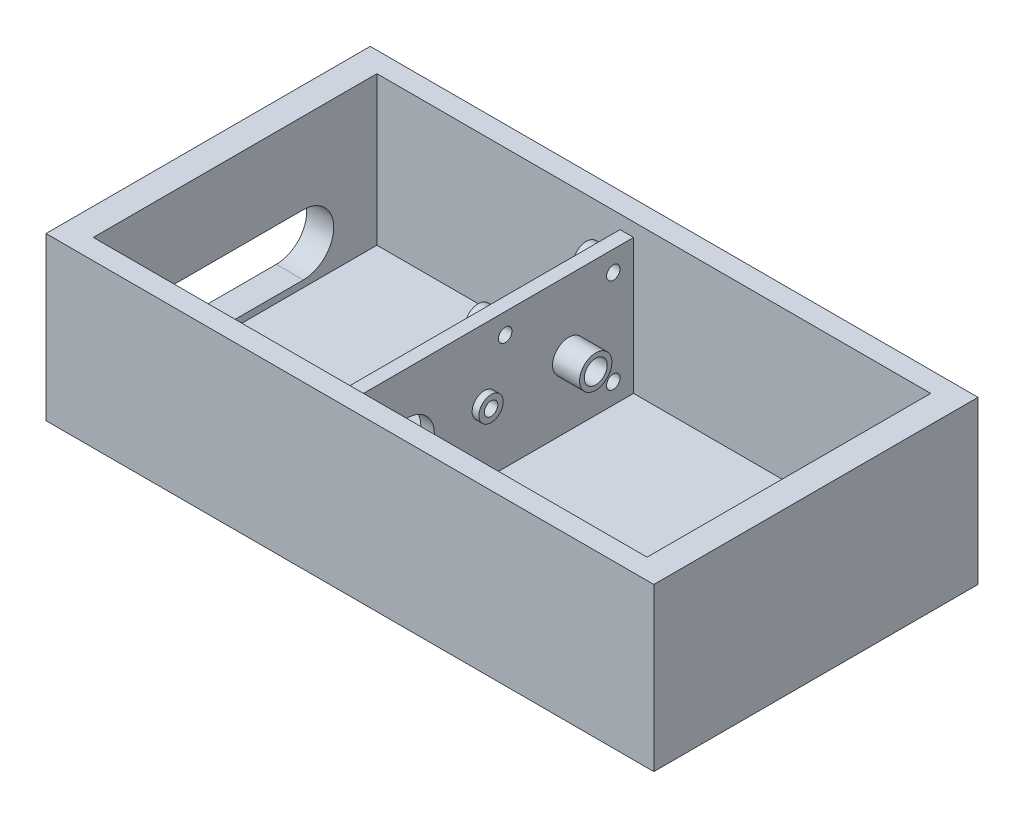
from build123d import *
from build123d.topology import SkipClean

# Parameters (mm, degrees)
SKETCH_2_W               = 24
SKETCH_2_H               = 12
EXTRUDE_1_DEPTH          = 45
SKETCH_3_W               = 41
SKETCH_3_H               = 21
CUT_EXTRUDE_1_DEPTH      = 11
CUT_EXTRUDE_2_DEPTH      = 2
SKETCH_7_W               = 1
SKETCH_7_H               = 21
EXTRUDE_4_DEPTH          = 10
SKETCH_8_R               = 0.85
CUT_EXTRUDE_3_DEPTH      = 3
SKETCH_9_R               = 1.2
EXTRUDE_5_DEPTH          = 2
CUT_EXTRUDE_START        = -2
SKETCH_10_R              = 0.85
CUT_EXTRUDE_4_DEPTH      = 2
SKETCH_11_R              = 0.9
EXTRUDE_6_DEPTH          = 0.5
CUT_EXTRUDE_5_DEPTH      = 17
CUT_EXTRUDE_5_DEPTH_BACK = 2
SKETCH_12_R              = 0.5
SKETCH_13_R              = 2
CUT_EXTRUDE_6_DEPTH      = 2
SKETCH_14_R              = 0.5
CUT_EXTRUDE_7_DEPTH      = 2
SKETCH_16_R              = 1
EXTRUDE_7_DEPTH          = 1
CUT_EXTRUDE_START_2      = -1
SKETCH_17_R              = 0.5
CUT_EXTRUDE_8_DEPTH      = 1
SKETCH_18_R              = 1
EXTRUDE_8_DEPTH          = 1
SKETCH_20_R              = 0.5
CUT_EXTRUDE_14_DEPTH     = 0.5


with BuildPart() as part:
    # 草图2 → 凸台-拉伸1 (new body)
    with BuildSketch(Plane(origin=(0, 0, 0), x_dir=(0, 0, -1), z_dir=(1, 0, 0))):
        Rectangle(SKETCH_2_W, SKETCH_2_H)
    extrude(amount=EXTRUDE_1_DEPTH)

    # 草图3 → 切除-拉伸1 (cut)
    with BuildSketch(Plane(origin=(0, 6, 0), x_dir=(1, 0, 0), z_dir=(0, 1, 0))):
        with Locations((22.5, 0)):
            Rectangle(SKETCH_3_W, SKETCH_3_H)
    extrude(amount=-CUT_EXTRUDE_1_DEPTH, mode=Mode.SUBTRACT)

    # 草图4 → 切除-拉伸2 (cut)
    with BuildSketch(Plane.ZY):
        with BuildLine():
            Line((-5.05, 0), (6.45, 0))
            ThreePointArc((6.45, 0), (8.7, -2.25), (6.45, -4.5))
            Line((6.45, -4.5), (-5.05, -4.5))
            ThreePointArc((-5.05, -4.5), (-7.3, -2.25), (-5.05, 0))
        make_face()
    extrude(amount=-CUT_EXTRUDE_2_DEPTH, mode=Mode.SUBTRACT)

    # 草图7 → 凸台-拉伸4 (add)
    with BuildSketch(Plane(origin=(0, -5, 0), x_dir=(1, 0, 0), z_dir=(0, 1, 0))):
        with Locations((20.5, 0)):
            Rectangle(SKETCH_7_W, SKETCH_7_H)
    extrude(amount=EXTRUDE_4_DEPTH)

    # 草图8 → 切除-拉伸3 (cut)
    with BuildSketch(Plane.ZY.offset(-20)):
        with Locations((-5.7, -0.2)):
            Circle(SKETCH_8_R)
    extrude(amount=-CUT_EXTRUDE_3_DEPTH, mode=Mode.SUBTRACT)

    # 草图9 → 凸台-拉伸5 (add)
    with BuildSketch(Plane(origin=(21, 0, 0), x_dir=(0, 0, -1), z_dir=(1, 0, 0))):
        with Locations((5.7, -0.2)):
            Circle(SKETCH_9_R)
    extrude(amount=EXTRUDE_5_DEPTH)

    # 草图10 → 切除-拉伸4 (cut)
    with SkipClean():  # the faces are left unmerged after this step: merging them gives an invalid solid
        with BuildSketch(Plane(origin=(23, 0, 0), x_dir=(0, 0, -1), z_dir=(1, 0, 0)).offset(CUT_EXTRUDE_START)):
            with Locations((5.7, -0.2)):
                Circle(SKETCH_10_R)
        extrude(amount=CUT_EXTRUDE_4_DEPTH, mode=Mode.SUBTRACT)

    # 草图11 → 凸台-拉伸6 (add)
    with SkipClean():  # the faces are left unmerged after this step: merging them gives an invalid solid
        with BuildSketch(Plane(origin=(21, 0, 0), x_dir=(0, 0, -1), z_dir=(1, 0, 0))):
            with Locations((-0.55, -0.2)):
                Circle(SKETCH_11_R)
        extrude(amount=EXTRUDE_6_DEPTH)

    # 草图12 → 切除-拉伸5 (cut, two sides: drawn at the far end of the back side and taken through both)
    with SkipClean():  # the faces are left unmerged after this step: merging them gives an invalid solid
        with BuildSketch(Plane(origin=(21.5, 0, 0), x_dir=(0, 0, -1), z_dir=(1, 0, 0)).offset(-CUT_EXTRUDE_5_DEPTH_BACK)):
            with Locations((-0.55, -0.2)):
                Circle(SKETCH_12_R)
        extrude(amount=CUT_EXTRUDE_5_DEPTH + CUT_EXTRUDE_5_DEPTH_BACK, mode=Mode.SUBTRACT)

    # 草图13 → 切除-拉伸6 (cut)
    with SkipClean():  # the faces are left unmerged after this step: merging them gives an invalid solid
        with BuildSketch(Plane(origin=(21, 0, 0), x_dir=(0, 0, -1), z_dir=(1, 0, 0))):
            with Locations((-6.25, -0.2)):
                Circle(SKETCH_13_R)
        extrude(amount=-CUT_EXTRUDE_6_DEPTH, mode=Mode.SUBTRACT)

    # 草图14 → 切除-拉伸7 (cut)
    with SkipClean():  # the faces are left unmerged after this step: merging them gives an invalid solid
        with BuildSketch(Plane(origin=(21, 0, 0), x_dir=(0, 0, -1), z_dir=(1, 0, 0))):
            with Locations((9, -3.5)):
                Circle(SKETCH_14_R)
            with Locations((9, 3.5)):
                Circle(SKETCH_14_R)
            with Locations((1, 3.5)):
                Circle(SKETCH_14_R)
        extrude(amount=-CUT_EXTRUDE_7_DEPTH, mode=Mode.SUBTRACT)

    # 草图16 → 凸台-拉伸7 (add)
    with SkipClean():  # the faces are left unmerged after this step: merging them gives an invalid solid
        with BuildSketch(Plane.ZY.offset(-20)):
            with Locations((-9, 3.5)):
                Circle(SKETCH_16_R)
            with Locations((-1, 3.5)):
                Circle(SKETCH_16_R)
            with Locations((-9, -3.5)):
                Circle(SKETCH_16_R)
        extrude(amount=EXTRUDE_7_DEPTH)

    # 草图17 → 切除-拉伸8 (cut)
    with SkipClean():  # the faces are left unmerged after this step: merging them gives an invalid solid
        with BuildSketch(Plane.ZY.offset(-19).offset(CUT_EXTRUDE_START_2)):
            with Locations((-9, 3.5)):
                Circle(SKETCH_17_R)
            with Locations((-1, 3.5)):
                Circle(SKETCH_17_R)
            with Locations((-9, -3.5)):
                Circle(SKETCH_17_R)
        extrude(amount=CUT_EXTRUDE_8_DEPTH, mode=Mode.SUBTRACT)

    # 草图18 → 凸台-拉伸8 (add)
    with SkipClean():  # the faces are left unmerged after this step: merging them gives an invalid solid
        with BuildSketch(Plane.ZY.offset(-20)):
            with Locations((0.55, -0.2)):
                Circle(SKETCH_18_R)
        extrude(amount=EXTRUDE_8_DEPTH)

    # 草图20 → 切除-拉伸14 (cut)
    with SkipClean():  # the faces are left unmerged after this step: merging them gives an invalid solid
        with BuildSketch(Plane(origin=(20, 0, 0), x_dir=(0, 0, -1), z_dir=(1, 0, 0))):
            with Locations((-0.55, -0.2)):
                Circle(SKETCH_20_R)
        extrude(amount=-CUT_EXTRUDE_14_DEPTH, mode=Mode.SUBTRACT)


solid = part.part
